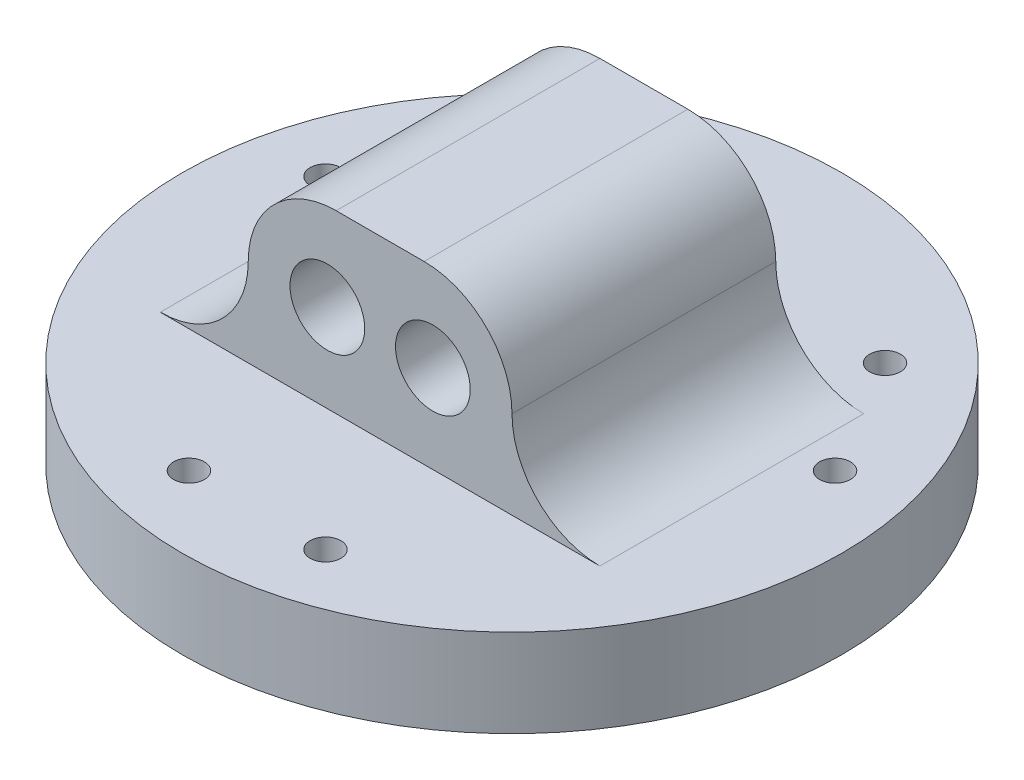
from build123d import *

# Parameters (mm, degrees)
SKETCH1_R           = 37.5
BOSS_EXTRUDE1_DEPTH = 10
SKETCH9_R           = 1.75
CUT_EXTRUDE5_DEPTH  = 54.967582862
CIRPATTERN3_COUNT   = 3
SKETCH10_W          = 30
SKETCH10_H          = 30
BOSS_EXTRUDE2_DEPTH = 20
SKETCH11_R          = 4.25
CUT_EXTRUDE6_DEPTH  = 72.151247354
FILLET1_START       = -15
FILLET1_DEPTH       = 30
FILLET1_2_DEPTH     = 30


with BuildPart() as part:
    # Sketch1 → Boss-Extrude1 (new body)
    with BuildSketch(Plane(origin=(0, 0, 0), x_dir=(1, 0, 0), z_dir=(0, 1, 0))):
        with Locations(Location((0, 0, 0), (0, 0, 270))):
            Circle(SKETCH1_R)
    extrude(amount=BOSS_EXTRUDE1_DEPTH)

    # Sketch9 → Cut-Extrude5 (cut, through all)
    with BuildSketch(Plane(origin=(0, 10, 0), x_dir=(1, 0, 0), z_dir=(0, 1, 0))):
        with Locations(Location((21.213203436, 21.213203436, 0), (0, 0, 270))):
            Circle(SKETCH9_R)
        with Locations(Location((28.977774789, 7.764571353, 0), (0, 0, 270))):
            Circle(SKETCH9_R)
    cut_extrude5 = extrude(amount=-CUT_EXTRUDE5_DEPTH, mode=Mode.SUBTRACT)

    # CirPattern3: Cut-Extrude5 ×3 about axis
    cirpattern3_axis = Axis((0, 0, 0), (0, 1, 0))
    for i in range(1, CIRPATTERN3_COUNT):
        add(cut_extrude5.rotate(cirpattern3_axis, i * 360 / CIRPATTERN3_COUNT), mode=Mode.SUBTRACT)

    # Sketch10 → Boss-Extrude2 (add)
    with BuildSketch(Plane(origin=(0, 10, 0), x_dir=(1, 0, 0), z_dir=(0, 1, 0))):
        Rectangle(SKETCH10_W, SKETCH10_H)
    extrude(amount=BOSS_EXTRUDE2_DEPTH)

    # Sketch11 → Cut-Extrude6 (cut, through all)
    with BuildSketch(Plane.XY.offset(-15)):
        with Locations(Location((6, 20, 0), (0, 0, 180))):
            Circle(SKETCH11_R)
        with Locations(Location((-6, 20, 0), (0, 0, 180))):
            Circle(SKETCH11_R)
    extrude(amount=CUT_EXTRUDE6_DEPTH, mode=Mode.SUBTRACT)

    # Fillet1: read off the stored shape, not the designer's step
    # Fillet1 outline → Fillet1 (cut)
    with BuildSketch(Plane.XY.offset(FILLET1_START)):
        with BuildLine():
            ThreePointArc((5, 30), (12.071067812, 27.071067812), (15, 20))
            Line((15, 20), (15, 30))
            Line((15, 30), (5, 30))
        make_face()
        with BuildLine():
            ThreePointArc((-15, 20), (-12.071067812, 27.071067812), (-5, 30))
            Line((-5, 30), (-15, 30))
            Line((-15, 30), (-15, 20))
        make_face()
    extrude(amount=FILLET1_DEPTH, mode=Mode.SUBTRACT)

    # Fillet1 2 outline → Fillet1 2 (add)
    with BuildSketch(Plane.XY.offset(FILLET1_START)):
        with BuildLine():
            ThreePointArc((25, 10), (17.928932188, 12.928932188), (15, 20))
            Line((15, 20), (15, 10))
            Line((15, 10), (25, 10))
        make_face()
        with BuildLine():
            Line((-25, 10), (-15, 10))
            Line((-15, 10), (-15, 20))
            ThreePointArc((-15, 20), (-17.928932188, 12.928932188), (-25, 10))
        make_face()
    extrude(amount=FILLET1_2_DEPTH)


solid = part.part
